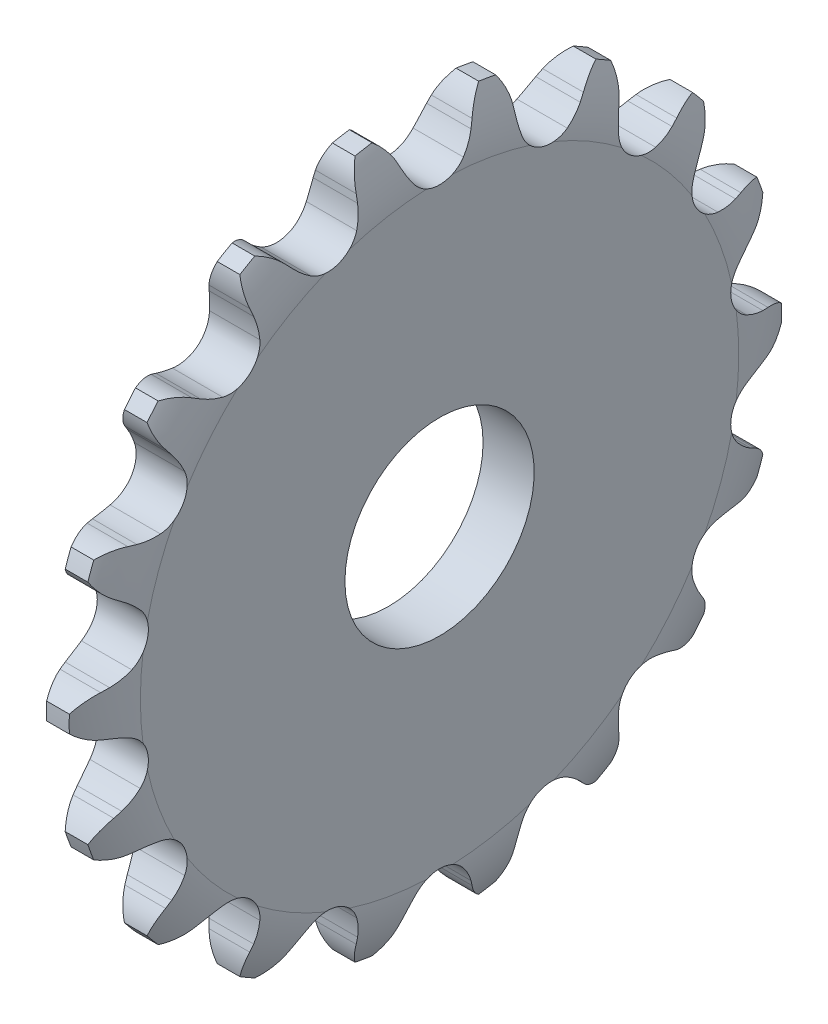
from build123d import *

# Parameters (mm, degrees)
TOOTHCUT_DEPTH  = 43.455441271
TEETHCUTS_COUNT = 18
TEETHCUTS_ANGLE = 340
BORSKE_R        = 7.9375
BORE_DEPTH      = 50.8000508


with BuildPart() as part:
    # BasProSke → Base-Revolve (revolve)
    with BuildSketch(Plane(origin=(0, 0, 0), x_dir=(1, 0, 0), z_dir=(0, 1, 0))):
        with BuildLine():
            Line((0, 0), (0, 25.091779697))
            ThreePointArc((0, 25.091779697), (0.302973008, 27.552861445), (1.1938, 29.866979697))
            Line((1.1938, 29.866979697), (3.094736, 29.866979697))
            ThreePointArc((3.094736, 29.866979697), (3.985562992, 27.552861445), (4.288536, 25.091779697))
            Line((4.288536, 25.091779697), (4.288536, 0))
            Line((4.288536, 0), (0, 0))
        make_face()
    revolve(axis=Axis((-10, 0, 0), (1, 0, 0)))

    # TooCutSke → ToothCut (cut, through all)
    with BuildSketch(Plane(origin=(0, 0, 0), x_dir=(0, 0, -1), z_dir=(1, 0, 0))):
        with BuildLine():
            Line((2.91755625, 27.299104928), (3.159984547, 27.858133533))
            ThreePointArc((3.159984547, 27.858133533), (4.704984353, 29.693963379), (7.00395274, 30.38101504))
            ThreePointArc((7.00395274, 30.38101504), (0, 31.177899686), (-7.00395274, 30.38101504))
            ThreePointArc((-7.00395274, 30.38101504), (-4.704984353, 29.693963379), (-3.159984547, 27.858133533))
            Line((-3.159984547, 27.858133533), (-2.91755625, 27.299104928))
            ThreePointArc((-2.91755625, 27.299104928), (-2.523047708, 26.530374597), (-2.032264105, 25.819238346))
            ThreePointArc((-2.032264105, 25.819238346), (0, 24.835344457), (2.032264105, 25.819238346))
            ThreePointArc((2.032264105, 25.819238346), (2.523047708, 26.530374597), (2.91755625, 27.299104928))
        make_face()
    toothcut = extrude(amount=TOOTHCUT_DEPTH, mode=Mode.SUBTRACT)

    # TeethCuts: ToothCut ×18 about axis
    teethcuts_axis = Axis((-10, 0, 0), (1, 0, 0))
    for i in range(1, TEETHCUTS_COUNT):
        add(toothcut.rotate(teethcuts_axis, i * TEETHCUTS_ANGLE / (TEETHCUTS_COUNT - 1)), mode=Mode.SUBTRACT)

    # BorSke → Bore (cut, symmetric)
    with BuildSketch(Plane(origin=(0, 0, 0), x_dir=(0, 0, -1), z_dir=(1, 0, 0))):
        Circle(BORSKE_R)
    extrude(amount=BORE_DEPTH, both=True, mode=Mode.SUBTRACT)


solid = part.part
